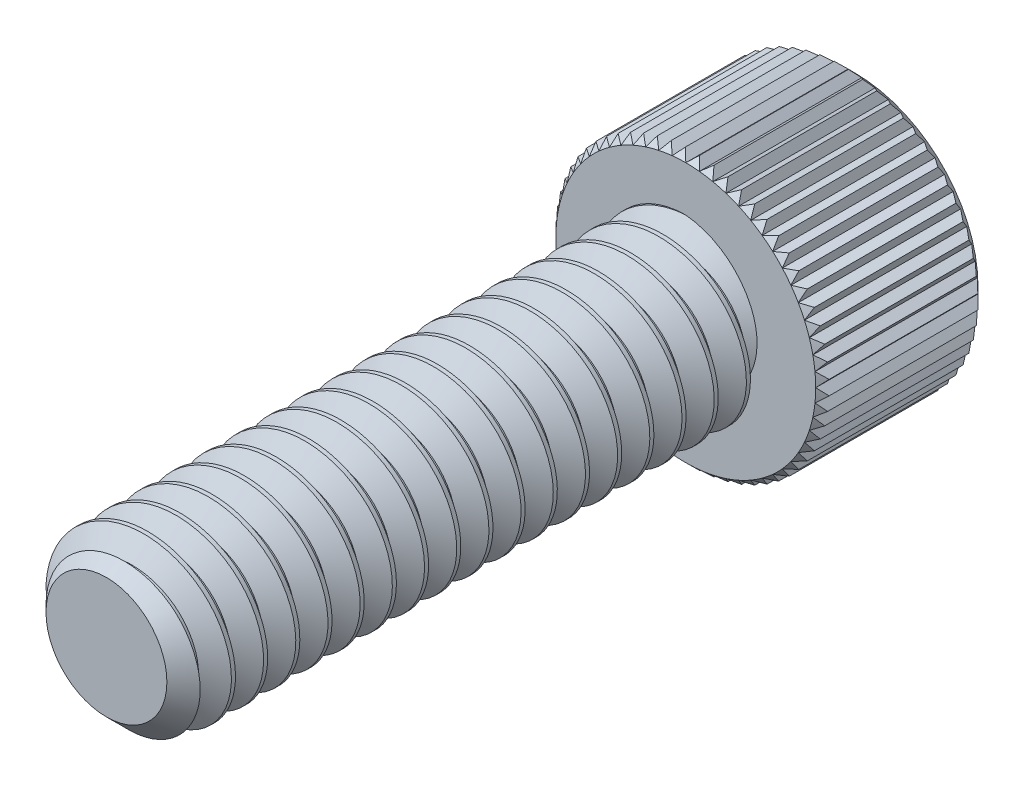
from build123d import *
from build123d.topology import SkipClean

# Parameters (mm, degrees)
SKETCH1_R          = 0.9271
EXTRUDE1_DEPTH     = 6.35
CHAMFER3_SIZE      = 0.264583333
CUT_SWEEP1_PITCH   = 0.352777778
SKETCH6_R          = 1.4986
EXTRUDE2_DEPTH     = 1.8542
CUT_EXTRUDE1_DEPTH = 1.190625
CHAMFER1_SIZE      = 0.14986
CHAMFER2_SIZE      = 0.07493
CUT_EXTRUDE3_DEPTH = 7.694333812
CIRPATTERN1_COUNT  = 60


with BuildPart() as part:
    # Sketch1 → Extrude1 (new body)
    with BuildSketch(Plane.XY):
        Circle(SKETCH1_R)
    extrude(amount=-EXTRUDE1_DEPTH)

    # Chamfer3
    chamfer3_edges = [part.edges().sort_by_distance(p)[0] for p in [
        (-0.9271, 0, 0),
    ]]
    chamfer(chamfer3_edges, length=CHAMFER3_SIZE)

    # Cut-Sweep1: the profile of Sketch3 profile screwed along a right-hand helix of 19 turns, 6 arcs to a turn; built about Z, then put on its axis
    cut_sweep1_z = Axis((0, 0, 0), (0, 0, 1))
    cut_sweep1_corners = [(0.9274, 0, -0.308853761), (0.697964112, 0, -0.176388889), (0.697964112, 0, -0.132291667), (0.9274, 0, 0.000173205)]
    with BuildLine(mode=Mode.PRIVATE) as cut_sweep1_profile:
        Line(cut_sweep1_corners[0], cut_sweep1_corners[1])
        Line(cut_sweep1_corners[1], cut_sweep1_corners[2])
        Line(cut_sweep1_corners[2], cut_sweep1_corners[3])
        Line(cut_sweep1_corners[3], cut_sweep1_corners[0])
    cut_sweep1_cap = Face(cut_sweep1_profile.wire())
    cut_sweep1_turn_angles = [0, 30, 60, 90, 120, 150, 180, 210, 240, 270, 300, 330, 360]
    cut_sweep1_turn_weights = [1, 0.8660254037844387, 1, 0.8660254037844387, 1, 0.8660254037844387, 1, 0.8660254037844387, 1, 0.8660254037844387, 1, 0.8660254037844387, 1]
    cut_sweep1_turn_rails = [Edge.make_bspline([Vector(p[0], p[1], 0).rotate(cut_sweep1_z, cut_sweep1_turn_angles[k]) / cut_sweep1_turn_weights[k] + Vector(0, 0, p[2] + CUT_SWEEP1_PITCH * cut_sweep1_turn_angles[k] / 360) for k in range(13)], [0, 0, 0, 1, 1, 2, 2, 3, 3, 4, 4, 5, 5, 6, 6, 6], 2, cut_sweep1_turn_weights) for p in cut_sweep1_corners]
    cut_sweep1_turn_sides = [Face.make_surface_from_curves(cut_sweep1_turn_rails[p[0]], cut_sweep1_turn_rails[p[1]]) for p in [(0, 1), (1, 2), (2, 3), (3, 0)]]
    cut_sweep1 = Plane(origin=(0, 0, 0), x_dir=(0, 1, 0), z_dir=(0, 0, -1)) * Solid(Shell([*[p.moved(Location((0, 0, CUT_SWEEP1_PITCH * i))) for i in range(19) for p in cut_sweep1_turn_sides], cut_sweep1_cap, cut_sweep1_cap.rotate(cut_sweep1_z, 6840).moved(Location((0, 0, CUT_SWEEP1_PITCH * 6840 / 360)))]))
    add(cut_sweep1, mode=Mode.SUBTRACT)

    # Sketch6 → Extrude2 (add)
    with BuildSketch(Plane(origin=(0, 0, -6.35), x_dir=(-1, 0, 0), z_dir=(0, 0, -1))):
        Circle(SKETCH6_R)
    extrude(amount=EXTRUDE2_DEPTH)

    # Sketch7 → Cut-Extrude1 (cut)
    with BuildSketch(Plane(origin=(0, 0, -8.2042), x_dir=(-1, 0, 0), z_dir=(0, 0, -1))):
        Polygon((0, 0.916543552), (-0.79375, 0.458271776), (-0.79375, -0.458271776), (0, -0.916543552), (0.79375, -0.458271776), (0.79375, 0.458271776), align=None)
    extrude(amount=-CUT_EXTRUDE1_DEPTH, mode=Mode.SUBTRACT)

    # Cut-Extrude2 cone 1 section (through the dimple's axis) → Cut-Extrude2 (revolve, cut)
    with BuildSketch(Plane(origin=(0, 0, -8.2042), x_dir=(0, 1, 0), z_dir=(1, 0, 0))):
        Polygon((0, 0), (0.916543552, 0), (0, 0.916543552), align=None)
    revolve(axis=Axis((0, 0, -8.2042), (0, 0, 1)), mode=Mode.SUBTRACT)

    # Chamfer1
    chamfer1_edges = [part.edges().sort_by_distance(p)[0] for p in [
        (1.4986, 0, -8.2042),
    ]]
    chamfer(chamfer1_edges, length=CHAMFER1_SIZE)

    # Chamfer2
    chamfer2_edges = [part.edges().sort_by_distance(p)[0] for p in [
        (1.4986, 0, -6.35),
    ]]
    chamfer(chamfer2_edges, length=CHAMFER2_SIZE)

    # Sketch10 → Cut-Extrude3 (cut, through all)
    with SkipClean():  # the faces are left unmerged after this step: merging them gives an invalid solid
        with BuildSketch(Plane.XY.offset(-6.35)):
            Polygon((-0.161281954, 1.57353), (0, 1.42367), (0.161281954, 1.57353), align=None)
        cut_extrude3 = extrude(amount=-CUT_EXTRUDE3_DEPTH, mode=Mode.SUBTRACT)

    # CirPattern1: Cut-Extrude3 ×60 about axis
    cirpattern1_axis = Axis((0, 0, 0), (0, 0, 1))
    for i in range(1, CIRPATTERN1_COUNT):
        add(cut_extrude3.rotate(cirpattern1_axis, i * 360 / CIRPATTERN1_COUNT), mode=Mode.SUBTRACT)


solid = part.part
